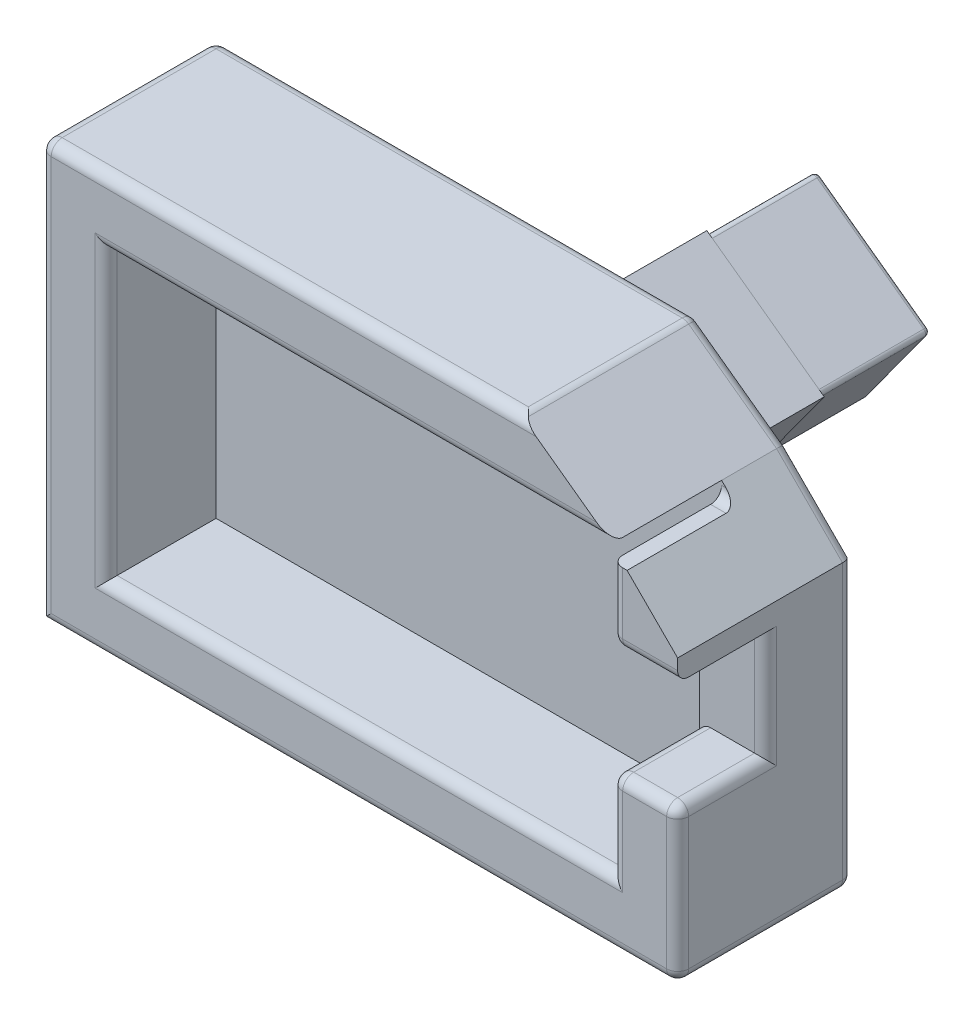
from build123d import *

# Parameters (mm, degrees)
BOSS_EXTRUDE1_DEPTH = 3
BOSS_EXTRUDE2_DEPTH = 5
SKETCH4_W           = 4
SKETCH4_H           = 5
CUT_EXTRUDE1_DEPTH  = 8
FILLET2_R           = 0.5
BOSS_EXTRUDE4_DEPTH = 14
BOSS_EXTRUDE5_DEPTH = 9
FILLET3_R           = 0.2


with BuildPart() as part:
    # Sketch1 → Boss-Extrude1 (new body)
    with BuildSketch(Plane.XY):
        Polygon((14.5, -9.5), (-14.5, -9.5), (-14.5, 9.5), (7.370854239, 9.5), (11.5, 6.5), (14.5, 3.5), align=None)
    extrude(amount=BOSS_EXTRUDE1_DEPTH)

    # Sketch2 → Boss-Extrude2 (add)
    with BuildSketch(Plane.XY.offset(3)):
        Polygon((11.5, -6.5), (-11.5, -6.5), (-11.5, 6.5), (11.5, 6.5), (7.370854239, 9.5), (-14.5, 9.5), (-14.5, -9.5), (14.5, -9.5), (14.5, 3.5), (12.2, 5.8), (11.5, 5.8), align=None)
    extrude(amount=BOSS_EXTRUDE2_DEPTH)

    # Sketch4 → Cut-Extrude1 (cut)
    with BuildSketch(Plane(origin=(14.5, 0, 0), x_dir=(0, 0, -1), z_dir=(1, 0, 0))):
        with Locations((-6, 0)):
            Rectangle(SKETCH4_W, SKETCH4_H)
    extrude(amount=-CUT_EXTRUDE1_DEPTH, mode=Mode.SUBTRACT)

    # Fillet2
    fillet2_edges = [part.edges().sort_by_distance(p)[0] for p in [
        (-14.5, 0, 0),
        (-14.5, 9.5, 4),
        (-3.564572881, 9.5, 0),
        (7.370854239, 9.5, 4),
        (9.435427119, 8, 0),
        (13, 5, 0),
        (0, -9.5, 0),
        (14.5, -3, 0),
        (14.5, -9.5, 4),
        (11.5, 2.5, 6),
        (11.85, 5.8, 3),
        (13, 2.5, 8),
        (14.5, 0, 4),
        (14.5, -2.5, 6),
        (11.5, -2.5, 6),
        (13, -2.5, 8),
        (14.5, -6, 8),
        (0, -9.5, 8),
        (-14.5, 0, 8),
        (-3.564572881, 9.5, 8),
        (-11.5, 0, 8),
        (0, -6.5, 8),
        (11.5, -4.5, 8),
        (0, 6.5, 8),
        (11.5, 4.15, 8),
    ]]
    fillet(fillet2_edges, radius=FILLET2_R)

    # Sketch3 → Boss-Extrude4 (add)
    with BuildSketch(Plane(origin=(0, 0, 0), x_dir=(-1, 0, 0), z_dir=(0, 0, -1))):
        Polygon((4.058317513, -0.141629679), (1.119391251, 3.903455293), (-4.058317513, 0.141629679), (-1.119391251, -3.903455293), align=None)
    extrude(amount=BOSS_EXTRUDE4_DEPTH)

    # Sketch3<5> → Boss-Extrude5 (add)
    with BuildSketch(Plane(origin=(0, 0, 0), x_dir=(-1, 0, 0), z_dir=(0, 0, -1))):
        Polygon((-4.168608475, 0.123302003), (1.170903688, 4.002684668), (4.168608475, -0.123302003), (-1.170903688, -4.002684668), align=None)
        Polygon((1.119391251, 3.903455293), (4.058317513, -0.141629679), (-1.119391251, -3.903455293), (-4.058317513, 0.141629679), align=None, mode=Mode.SUBTRACT)
    extrude(amount=BOSS_EXTRUDE5_DEPTH)

    # Fillet3
    fillet3_edges = [part.edges().sort_by_distance(p)[0] for p in [
        (-1.119391251, 3.903455293, -11.5),
        (-2.588854382, 1.880912807, -14),
        (1.469463131, 2.022542486, -14),
        (-1.469463131, -2.022542486, -14),
        (2.588854382, -1.880912807, -14),
        (4.058317513, 0.141629679, -11.5),
        (-4.058317513, -0.141629679, -11.5),
        (1.119391251, -3.903455293, -11.5),
    ]]
    fillet(fillet3_edges, radius=FILLET3_R)


solid = part.part
